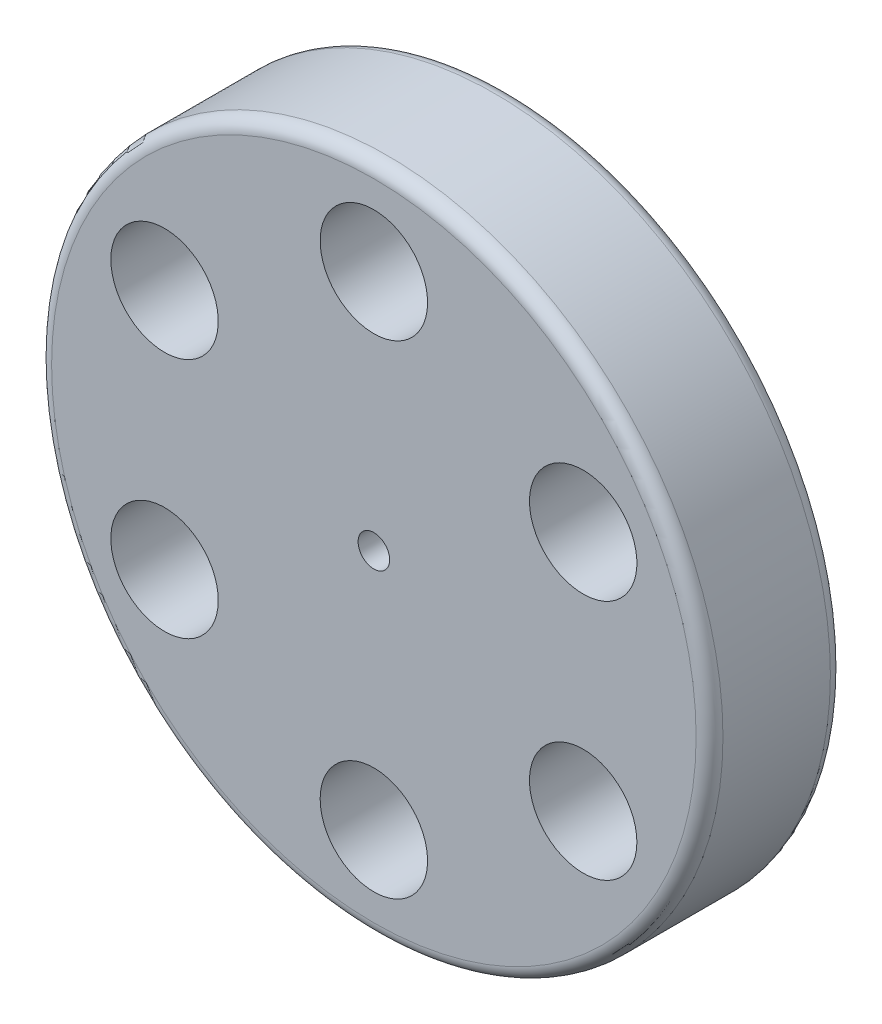
from build123d import *

# Parameters (mm, degrees)
SKETCH1_R           = 25
BOSS_EXTRUDE1_DEPTH = 10
SKETCH2_R           = 1.175
CUT_EXTRUDE2_DEPTH  = 9
SKETCH3_R           = 4
CUT_EXTRUDE3_DEPTH  = 37.742346142
CIRPATTERN1_COUNT   = 6
FILLET1_R           = 1


with BuildPart() as part:
    # Sketch1 → Boss-Extrude1 (new body)
    with BuildSketch(Plane.XY):
        Circle(SKETCH1_R)
    extrude(amount=BOSS_EXTRUDE1_DEPTH)

    # Sketch2 → Cut-Extrude2 (cut)
    with BuildSketch(Plane.XY.offset(10)):
        Circle(SKETCH2_R)
    extrude(amount=-CUT_EXTRUDE2_DEPTH, mode=Mode.SUBTRACT)

    # Sketch3 → Cut-Extrude3 (cut, through all)
    with BuildSketch(Plane.XY.offset(10)):
        with Locations((0, 18)):
            Circle(SKETCH3_R)
    cut_extrude3 = extrude(amount=-CUT_EXTRUDE3_DEPTH, mode=Mode.SUBTRACT)

    # CirPattern1: Cut-Extrude3 ×6 about axis
    cirpattern1_axis = Axis((0, 0, 10), (0, 0, 1))
    for i in range(1, CIRPATTERN1_COUNT):
        add(cut_extrude3.rotate(cirpattern1_axis, i * 360 / CIRPATTERN1_COUNT), mode=Mode.SUBTRACT)

    # Fillet1
    fillet1_edges = [part.edges().sort_by_distance(p)[0] for p in [
        (-25, 0, 0),
        (-25, 0, 10),
    ]]
    fillet(fillet1_edges, radius=FILLET1_R)


solid = part.part
